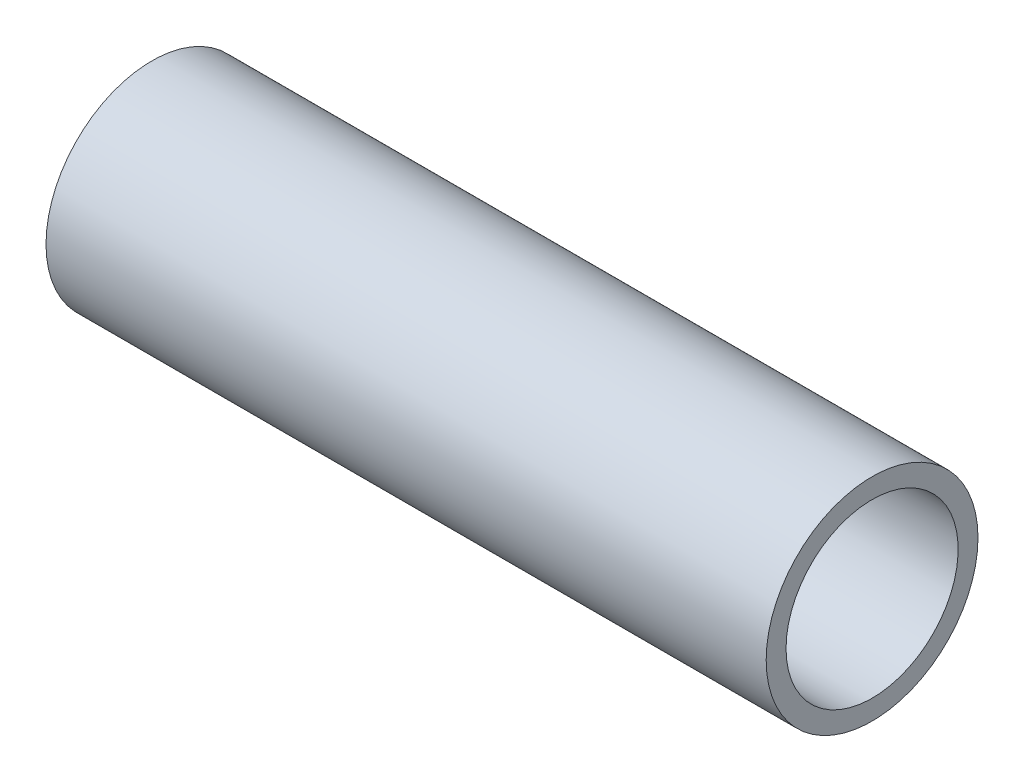
from build123d import *

# Parameters (mm, degrees)
ESQUISSE1_W = 136
ESQUISSE1_H = 3.75


with BuildPart() as part:
    # Esquisse1 → Révolution1 (revolve)
    with BuildSketch(Plane.XY):
        with Locations((170, -152.698977934)):
            Rectangle(ESQUISSE1_W, ESQUISSE1_H)
    revolve(axis=Axis((136.33475339, -170.823977934, 0), (1, 0, 0)))


solid = part.part
